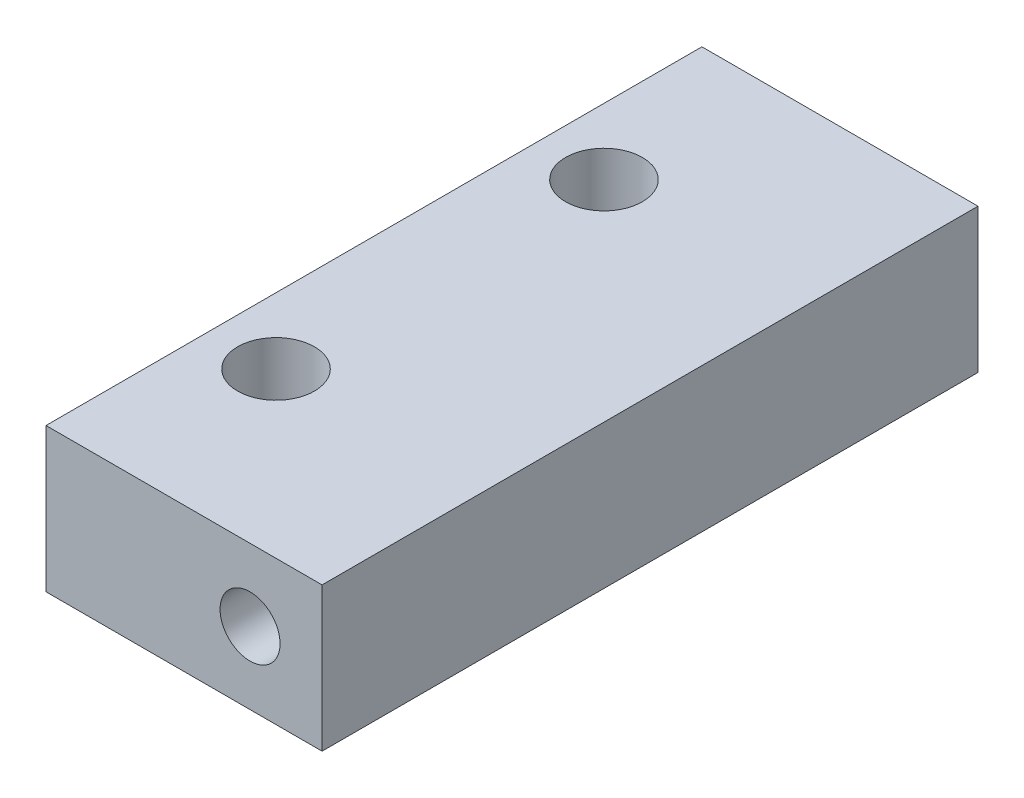
from build123d import *

# Parameters (mm, degrees)
SKETCH1_W           = 11.5
SKETCH1_H           = 27.323
SKETCH1_R           = 1.6
BOSS_EXTRUDE1_DEPTH = 6
SKETCH2_R           = 1.25
CUT_EXTRUDE1_DEPTH  = 31.245600159


with BuildPart() as part:
    # Sketch1 → Boss-Extrude1 (new body)
    with BuildSketch(Plane(origin=(0, 0, 0), x_dir=(1, 0, 0), z_dir=(0, 1, 0))):
        with Locations((5.75, 13.6615)):
            Rectangle(SKETCH1_W, SKETCH1_H)
        with Locations((2.75, 20.492)):
            Circle(SKETCH1_R, mode=Mode.SUBTRACT)
        with Locations((2.75, 6.831)):
            Circle(SKETCH1_R, mode=Mode.SUBTRACT)
    extrude(amount=BOSS_EXTRUDE1_DEPTH)

    # Sketch2 → Cut-Extrude1 (cut, through all)
    with BuildSketch(Plane.XY):
        with Locations((8.5, 3)):
            Circle(SKETCH2_R)
    extrude(amount=-CUT_EXTRUDE1_DEPTH, mode=Mode.SUBTRACT)


solid = part.part
